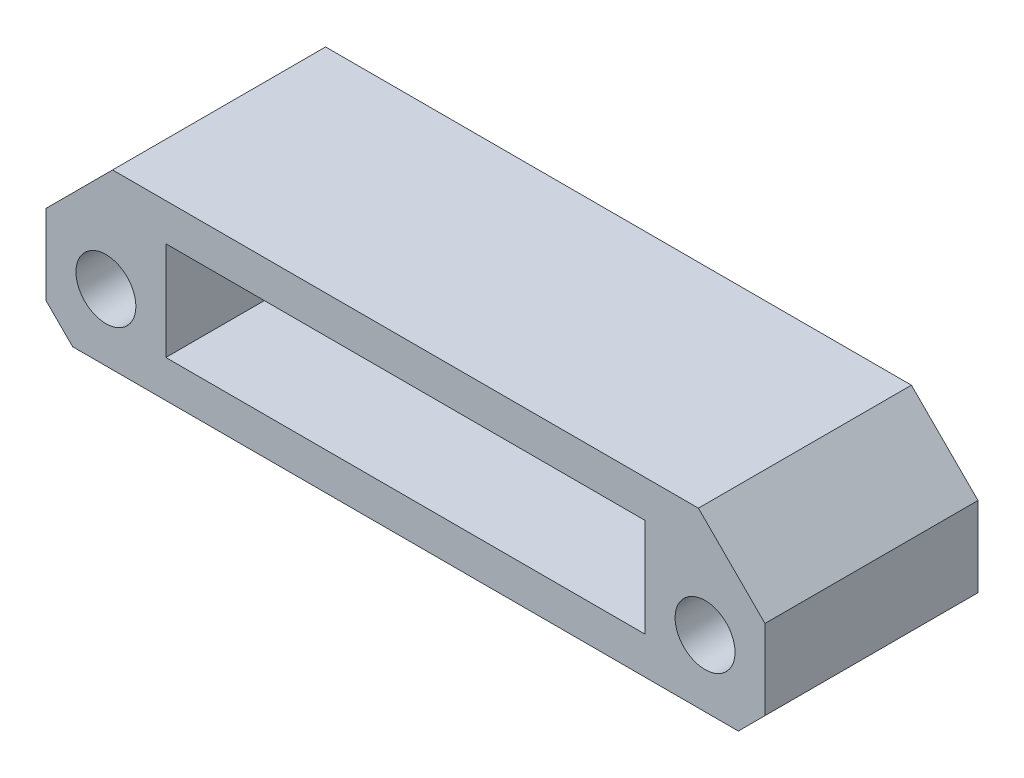
from build123d import *

# Parameters (mm, degrees)
SKETCH1_W           = 36
SKETCH1_H           = 7.4
BOSS_EXTRUDE1_DEPTH = 16
CHAMFER1_SIZE       = 2
SKETCH2_R           = 2.25
CUT_EXTRUDE1_DEPTH  = 16
CHAMFER3_SIZE       = 5


with BuildPart() as part:
    # Sketch1 → Boss-Extrude1 (new body)
    with BuildSketch(Plane.XY):
        Polygon((0, 0), (0, 13), (54, 13), (54, 0), (45, 0), (9, 0), align=None)
        with Locations((27, 6.5)):
            Rectangle(SKETCH1_W, SKETCH1_H, mode=Mode.SUBTRACT)
    extrude(amount=BOSS_EXTRUDE1_DEPTH)

    # Chamfer1
    chamfer1_edges = [part.edges().sort_by_distance(p)[0] for p in [
        (54, 0, 8),
        (0, 0, 8),
    ]]
    chamfer(chamfer1_edges, length=CHAMFER1_SIZE)

    # Sketch2 → Cut-Extrude1 (cut)
    with BuildSketch(Plane.XY.offset(16)):
        with Locations((4.5, 5)):
            Circle(SKETCH2_R)
        with Locations((49.5, 5)):
            Circle(SKETCH2_R)
    extrude(amount=-CUT_EXTRUDE1_DEPTH, mode=Mode.SUBTRACT)

    # Chamfer3
    chamfer3_edges = [part.edges().sort_by_distance(p)[0] for p in [
        (54, 13, 8),
        (0, 13, 8),
    ]]
    chamfer(chamfer3_edges, length=CHAMFER3_SIZE)


solid = part.part
